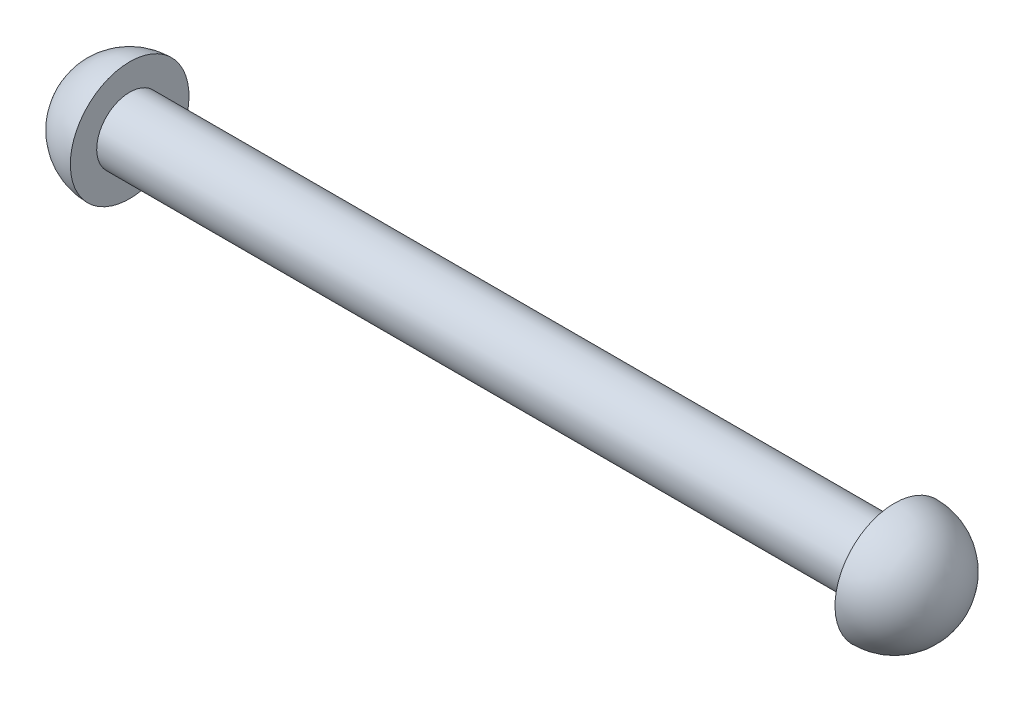
from build123d import *


with BuildPart() as part:
    # Sketch1 → Revolve1 (revolve)
    with BuildSketch(Plane.XY):
        with BuildLine():
            Line((0, 6.35), (0, 8.89))
            ThreePointArc((0, 8.89), (-4.041115254, 7.216115254), (-5.715, 3.175))
            Line((-5.715, 3.175), (79.375, 3.175))
            ThreePointArc((79.375, 3.175), (77.701115254, 7.216115254), (73.66, 8.89))
            Line((73.66, 8.89), (73.66, 6.35))
            Line((73.66, 6.35), (0, 6.35))
        make_face()
    revolve(axis=Axis((79.375, 3.175, 0), (-1, 0, 0)))


solid = part.part
